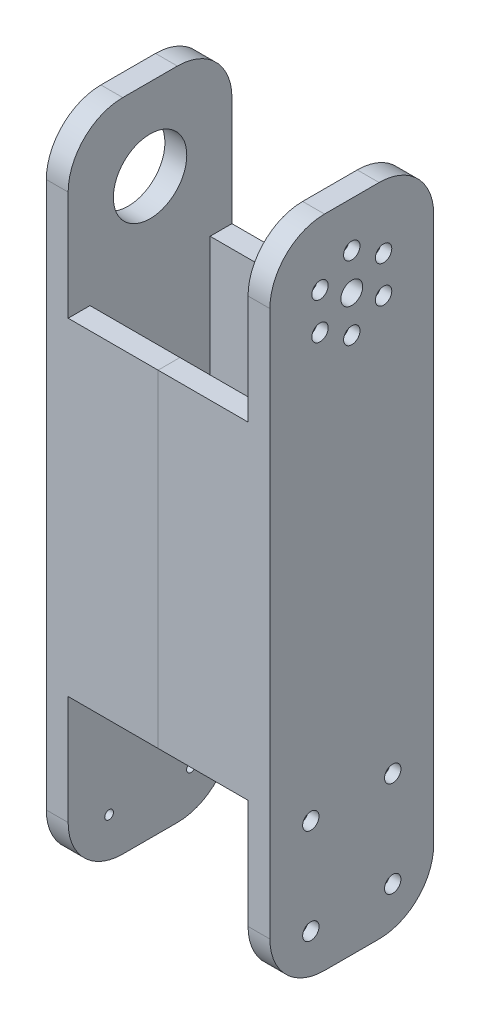
from build123d import *

# Parameters (mm, degrees)
SKETCH_1_W          = 60
SKETCH_1_H          = 240
EXTRUDE_1_DEPTH     = 8
SKETCH_2_R          = 13.45
CUT_EXTRUDE_1_DEPTH = 124.951603459
SKETCH_3_W          = 8
SKETCH_3_H          = 120
EXTRUDE_2_DEPTH     = 65.9
SKETCH_4_W          = 60
SKETCH_4_H          = 240
EXTRUDE_3_DEPTH     = 8
FILLET_1_R          = 20
CUT_EXTRUDE_2_REACH = 150.35
SKETCH_10_R         = 4
SKETCH_10_R_2       = 1.6
SKETCH_15_R         = 18
EXTRUDE_4_DEPTH     = 9.8
SKETCH_11_R         = 1.6
CUT_EXTRUDE_3_DEPTH = 149.349620829
SKETCH_12_R         = 3
CUT_EXTRUDE_4_DEPTH = 4
SKETCH_13_R         = 3
CUT_EXTRUDE_5_DEPTH = 4
CUT_EXTRUDE_START   = -4
SKETCH_14_R         = 3
CUT_EXTRUDE_6_DEPTH = 4
CUT_EXTRUDE_7_REACH = 150.35
SKETCH_10_2_R       = 4
SKETCH_10_2_R_2     = 1.6


with BuildPart() as part:
    # 草图1 → 凸台-拉伸1 (new body)
    with BuildSketch(Plane(origin=(0, 0, 0), x_dir=(0, 0, -1), z_dir=(1, 0, 0))):
        Rectangle(SKETCH_1_W, SKETCH_1_H)
    extrude(amount=EXTRUDE_1_DEPTH)

    # 草图2 → 切除-拉伸1 (cut, through all)
    with BuildSketch(Plane(origin=(8, 0, 0), x_dir=(0, 0, -1), z_dir=(1, 0, 0))):
        with Locations((0, 90)):
            Circle(SKETCH_2_R)
    extrude(amount=-CUT_EXTRUDE_1_DEPTH, mode=Mode.SUBTRACT)

    # 草图3 → 凸台-拉伸2 (add)
    with BuildSketch(Plane(origin=(8, 0, 0), x_dir=(0, 0, -1), z_dir=(1, 0, 0))):
        with Locations((-26, 0)):
            Rectangle(SKETCH_3_W, SKETCH_3_H)
        with Locations((26, 0)):
            Rectangle(SKETCH_3_W, SKETCH_3_H)
    extrude(amount=EXTRUDE_2_DEPTH)

    # 草图4 → 凸台-拉伸3 (add)
    with BuildSketch(Plane(origin=(73.9, 0, 0), x_dir=(0, 0, -1), z_dir=(1, 0, 0))):
        Rectangle(SKETCH_4_W, SKETCH_4_H)
    extrude(amount=EXTRUDE_3_DEPTH)

    # 圆角1
    fillet_1_edges = [part.edges().sort_by_distance(p)[0] for p in [
        (4, -120, 30),
        (4, -120, -30),
        (4, 120, -30),
        (4, 120, 30),
        (77.9, 120, -30),
        (77.9, 120, 30),
        (77.9, -120, -30),
        (77.9, -120, 30),
    ]]
    fillet(fillet_1_edges, radius=FILLET_1_R)

    # 草图10 → 切除-拉伸2 (cut, up to next)
    with BuildSketch(Plane(origin=(81.9, 0, 0), x_dir=(0, 0, -1), z_dir=(1, 0, 0)), mode=Mode.PRIVATE) as cut_extrude_2_sk1:
        with Locations((0, 90)):
            Circle(SKETCH_10_R)
    cut_extrude_2_tool1 = extrude(cut_extrude_2_sk1.sketch, amount=-CUT_EXTRUDE_2_REACH, mode=Mode.PRIVATE) & part.part
    # 草图10 → 切除-拉伸2 (cut, up to next)
    with BuildSketch(Plane(origin=(81.9, 0, 0), x_dir=(0, 0, -1), z_dir=(1, 0, 0)), mode=Mode.PRIVATE) as cut_extrude_2_sk2:
        with Locations((0, 103.5)):
            Circle(SKETCH_10_R_2)
    cut_extrude_2_tool2 = extrude(cut_extrude_2_sk2.sketch, amount=-CUT_EXTRUDE_2_REACH, mode=Mode.PRIVATE) & part.part
    # 草图10 → 切除-拉伸2 (cut, up to next)
    with BuildSketch(Plane(origin=(81.9, 0, 0), x_dir=(0, 0, -1), z_dir=(1, 0, 0)), mode=Mode.PRIVATE) as cut_extrude_2_sk3:
        with Locations((11.691342951, 96.75)):
            Circle(SKETCH_10_R_2)
    cut_extrude_2_tool3 = extrude(cut_extrude_2_sk3.sketch, amount=-CUT_EXTRUDE_2_REACH, mode=Mode.PRIVATE) & part.part
    # 草图10 → 切除-拉伸2 (cut, up to next)
    with BuildSketch(Plane(origin=(81.9, 0, 0), x_dir=(0, 0, -1), z_dir=(1, 0, 0)), mode=Mode.PRIVATE) as cut_extrude_2_sk4:
        with Locations((11.691342951, 83.25)):
            Circle(SKETCH_10_R_2)
    cut_extrude_2_tool4 = extrude(cut_extrude_2_sk4.sketch, amount=-CUT_EXTRUDE_2_REACH, mode=Mode.PRIVATE) & part.part
    # 草图10 → 切除-拉伸2 (cut, up to next)
    with BuildSketch(Plane(origin=(81.9, 0, 0), x_dir=(0, 0, -1), z_dir=(1, 0, 0)), mode=Mode.PRIVATE) as cut_extrude_2_sk5:
        with Locations((0, 76.5)):
            Circle(SKETCH_10_R_2)
    cut_extrude_2_tool5 = extrude(cut_extrude_2_sk5.sketch, amount=-CUT_EXTRUDE_2_REACH, mode=Mode.PRIVATE) & part.part
    # 草图10 → 切除-拉伸2 (cut, up to next)
    with BuildSketch(Plane(origin=(81.9, 0, 0), x_dir=(0, 0, -1), z_dir=(1, 0, 0)), mode=Mode.PRIVATE) as cut_extrude_2_sk6:
        with Locations((-11.691342951, 83.25)):
            Circle(SKETCH_10_R_2)
    cut_extrude_2_tool6 = extrude(cut_extrude_2_sk6.sketch, amount=-CUT_EXTRUDE_2_REACH, mode=Mode.PRIVATE) & part.part
    # 草图10 → 切除-拉伸2 (cut, up to next)
    with BuildSketch(Plane(origin=(81.9, 0, 0), x_dir=(0, 0, -1), z_dir=(1, 0, 0)), mode=Mode.PRIVATE) as cut_extrude_2_sk7:
        with Locations((-11.691342951, 96.75)):
            Circle(SKETCH_10_R_2)
    cut_extrude_2_tool7 = extrude(cut_extrude_2_sk7.sketch, amount=-CUT_EXTRUDE_2_REACH, mode=Mode.PRIVATE) & part.part
    add(cut_extrude_2_tool1.solids().sort_by_distance((81.9, 90, 0))[0], mode=Mode.SUBTRACT)
    add(cut_extrude_2_tool2.solids().sort_by_distance((81.9, 103.5, 0))[0], mode=Mode.SUBTRACT)
    add(cut_extrude_2_tool3.solids().sort_by_distance((81.9, 96.75, -11.691343))[0], mode=Mode.SUBTRACT)
    add(cut_extrude_2_tool4.solids().sort_by_distance((81.9, 83.25, -11.691343))[0], mode=Mode.SUBTRACT)
    add(cut_extrude_2_tool5.solids().sort_by_distance((81.9, 76.5, 0))[0], mode=Mode.SUBTRACT)
    add(cut_extrude_2_tool6.solids().sort_by_distance((81.9, 83.25, 11.691343))[0], mode=Mode.SUBTRACT)
    add(cut_extrude_2_tool7.solids().sort_by_distance((81.9, 96.75, 11.691343))[0], mode=Mode.SUBTRACT)

    # 草图15 → 凸台-拉伸4 (add)
    with BuildSketch(Plane.ZY.offset(-73.9)):
        with Locations((0, 90)):
            Circle(SKETCH_15_R)
    extrude(amount=EXTRUDE_4_DEPTH)

    # 草图11 → 切除-拉伸3 (cut, through all)
    with BuildSketch(Plane(origin=(81.9, 0, 0), x_dir=(0, 0, -1), z_dir=(1, 0, 0))):
        with Locations((-15, -70)):
            Circle(SKETCH_11_R)
        with Locations((15, -70)):
            Circle(SKETCH_11_R)
        with Locations((15, -105)):
            Circle(SKETCH_11_R)
        with Locations((-15, -105)):
            Circle(SKETCH_11_R)
    extrude(amount=-CUT_EXTRUDE_3_DEPTH, mode=Mode.SUBTRACT)

    # 草图12 → 切除-拉伸4 (cut)
    with BuildSketch(Plane(origin=(81.9, 0, 0), x_dir=(0, 0, -1), z_dir=(1, 0, 0))):
        with Locations((0, 103.45)):
            Circle(SKETCH_12_R)
        with Locations((11.648041681, 96.725)):
            Circle(SKETCH_12_R)
        with Locations((11.648041681, 83.275)):
            Circle(SKETCH_12_R)
        with Locations((0, 76.55)):
            Circle(SKETCH_12_R)
        with Locations((-11.648041681, 83.275)):
            Circle(SKETCH_12_R)
        with Locations((-11.648041681, 96.725)):
            Circle(SKETCH_12_R)
    extrude(amount=-CUT_EXTRUDE_4_DEPTH, mode=Mode.SUBTRACT)

    # 草图13 → 切除-拉伸5 (cut)
    with BuildSketch(Plane(origin=(81.9, 0, 0), x_dir=(0, 0, -1), z_dir=(1, 0, 0))):
        with Locations((-15, -70)):
            Circle(SKETCH_13_R)
        with Locations((15, -70)):
            Circle(SKETCH_13_R)
        with Locations((15, -105)):
            Circle(SKETCH_13_R)
        with Locations((-15, -105)):
            Circle(SKETCH_13_R)
    extrude(amount=-CUT_EXTRUDE_5_DEPTH, mode=Mode.SUBTRACT)

    # 草图14 → 切除-拉伸6 (cut)
    with BuildSketch(Plane.ZY.offset(CUT_EXTRUDE_START)):
        with Locations((-15, -70)):
            Circle(SKETCH_14_R)
        with Locations((15, -70)):
            Circle(SKETCH_14_R)
        with Locations((15, -105)):
            Circle(SKETCH_14_R)
        with Locations((-15, -105)):
            Circle(SKETCH_14_R)
    extrude(amount=CUT_EXTRUDE_6_DEPTH, mode=Mode.SUBTRACT)

    # 草图10<2> → 切除-拉伸7 (cut, up to next)
    with BuildSketch(Plane(origin=(81.9, 0, 0), x_dir=(0, 0, -1), z_dir=(1, 0, 0)), mode=Mode.PRIVATE) as cut_extrude_7_sk1:
        with Locations((0, 90)):
            Circle(SKETCH_10_2_R)
    cut_extrude_7_tool1 = extrude(cut_extrude_7_sk1.sketch, amount=-CUT_EXTRUDE_7_REACH, mode=Mode.PRIVATE) & part.part
    # 草图10<2> → 切除-拉伸7 (cut, up to next)
    with BuildSketch(Plane(origin=(81.9, 0, 0), x_dir=(0, 0, -1), z_dir=(1, 0, 0)), mode=Mode.PRIVATE) as cut_extrude_7_sk2:
        with Locations((0, 103.5)):
            Circle(SKETCH_10_2_R_2)
    cut_extrude_7_tool2 = extrude(cut_extrude_7_sk2.sketch, amount=-CUT_EXTRUDE_7_REACH, mode=Mode.PRIVATE) & part.part
    # 草图10<2> → 切除-拉伸7 (cut, up to next)
    with BuildSketch(Plane(origin=(81.9, 0, 0), x_dir=(0, 0, -1), z_dir=(1, 0, 0)), mode=Mode.PRIVATE) as cut_extrude_7_sk3:
        with Locations((11.691342951, 96.75)):
            Circle(SKETCH_10_2_R_2)
    cut_extrude_7_tool3 = extrude(cut_extrude_7_sk3.sketch, amount=-CUT_EXTRUDE_7_REACH, mode=Mode.PRIVATE) & part.part
    # 草图10<2> → 切除-拉伸7 (cut, up to next)
    with BuildSketch(Plane(origin=(81.9, 0, 0), x_dir=(0, 0, -1), z_dir=(1, 0, 0)), mode=Mode.PRIVATE) as cut_extrude_7_sk4:
        with Locations((11.691342951, 83.25)):
            Circle(SKETCH_10_2_R_2)
    cut_extrude_7_tool4 = extrude(cut_extrude_7_sk4.sketch, amount=-CUT_EXTRUDE_7_REACH, mode=Mode.PRIVATE) & part.part
    # 草图10<2> → 切除-拉伸7 (cut, up to next)
    with BuildSketch(Plane(origin=(81.9, 0, 0), x_dir=(0, 0, -1), z_dir=(1, 0, 0)), mode=Mode.PRIVATE) as cut_extrude_7_sk5:
        with Locations((0, 76.5)):
            Circle(SKETCH_10_2_R_2)
    cut_extrude_7_tool5 = extrude(cut_extrude_7_sk5.sketch, amount=-CUT_EXTRUDE_7_REACH, mode=Mode.PRIVATE) & part.part
    # 草图10<2> → 切除-拉伸7 (cut, up to next)
    with BuildSketch(Plane(origin=(81.9, 0, 0), x_dir=(0, 0, -1), z_dir=(1, 0, 0)), mode=Mode.PRIVATE) as cut_extrude_7_sk6:
        with Locations((-11.691342951, 83.25)):
            Circle(SKETCH_10_2_R_2)
    cut_extrude_7_tool6 = extrude(cut_extrude_7_sk6.sketch, amount=-CUT_EXTRUDE_7_REACH, mode=Mode.PRIVATE) & part.part
    # 草图10<2> → 切除-拉伸7 (cut, up to next)
    with BuildSketch(Plane(origin=(81.9, 0, 0), x_dir=(0, 0, -1), z_dir=(1, 0, 0)), mode=Mode.PRIVATE) as cut_extrude_7_sk7:
        with Locations((-11.691342951, 96.75)):
            Circle(SKETCH_10_2_R_2)
    cut_extrude_7_tool7 = extrude(cut_extrude_7_sk7.sketch, amount=-CUT_EXTRUDE_7_REACH, mode=Mode.PRIVATE) & part.part
    add(cut_extrude_7_tool1.solids().sort_by_distance((81.9, 90, 0))[0], mode=Mode.SUBTRACT)
    add(cut_extrude_7_tool2.solids().sort_by_distance((81.9, 103.5, 0))[0], mode=Mode.SUBTRACT)
    add(cut_extrude_7_tool3.solids().sort_by_distance((81.9, 96.75, -11.691343))[0], mode=Mode.SUBTRACT)
    add(cut_extrude_7_tool4.solids().sort_by_distance((81.9, 83.25, -11.691343))[0], mode=Mode.SUBTRACT)
    add(cut_extrude_7_tool5.solids().sort_by_distance((81.9, 76.5, 0))[0], mode=Mode.SUBTRACT)
    add(cut_extrude_7_tool6.solids().sort_by_distance((81.9, 83.25, 11.691343))[0], mode=Mode.SUBTRACT)
    add(cut_extrude_7_tool7.solids().sort_by_distance((81.9, 96.75, 11.691343))[0], mode=Mode.SUBTRACT)


with BuildPart() as body_2:
    # Split Bodies 1: the piece on the far side of the plane
    add(part.part)
    split(bisect_by=Plane(origin=(40.95, 0, 0), x_dir=(0, 0, 1), z_dir=(1, 0, 0)), keep=Keep.BOTTOM)


with BuildPart() as part_1:
    add(part.part)

    # Split Bodies 1
    split(bisect_by=Plane(origin=(40.95, 0, 0), x_dir=(0, 0, 1), z_dir=(1, 0, 0)), keep=Keep.TOP)


solid = Compound([body_2.part, part_1.part])
